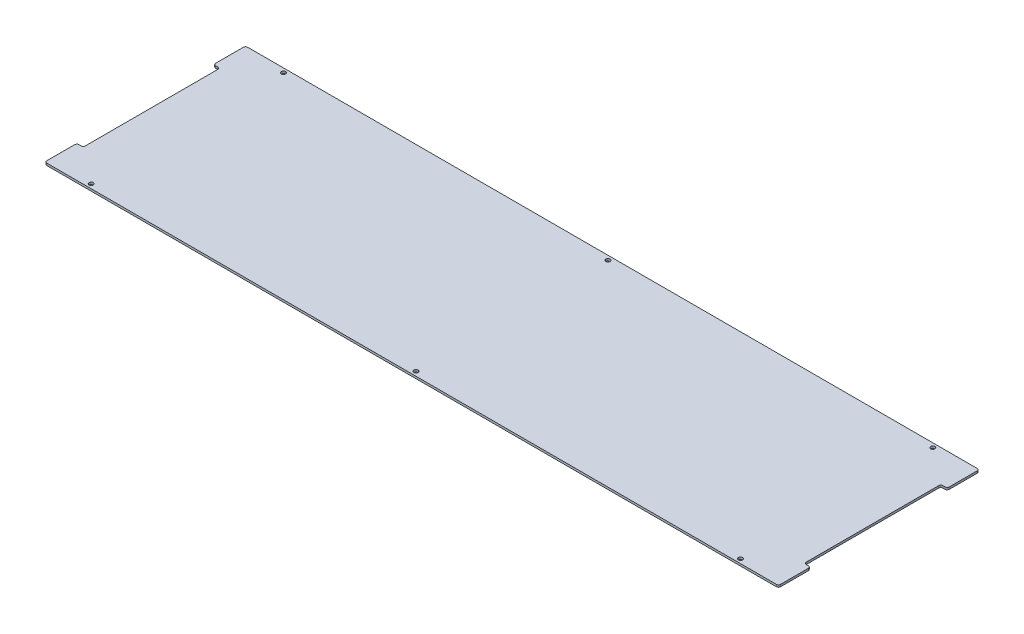
from build123d import *

# Parameters (mm, degrees)
SKETCH1_W                   = 1090.6125
SKETCH1_H                   = 298.45
BOSS_EXTRUDE1_DEPTH         = 3.175
SKETCH2_W                   = 9.525
SKETCH2_H                   = 203.2
CUT_EXTRUDE1_DEPTH          = 566.364561623
FILLET1_R                   = 3.175
FILLET1_OF_MIRROR1_R        = 3.175
F_1_4_0_25_DIAMETER_HOLE1_D = 6.35
FILLET2_R                   = 3.175


with BuildPart() as part:
    # Sketch1 → Boss-Extrude1 (new body)
    with BuildSketch(Plane(origin=(0, 0, 0), x_dir=(1, 0, 0), z_dir=(0, 1, 0))):
        Rectangle(SKETCH1_W, SKETCH1_H)
    extrude(amount=BOSS_EXTRUDE1_DEPTH)

    # Sketch2 → Cut-Extrude1 (cut, through all)
    with BuildSketch(Plane(origin=(0, 3.175, 0), x_dir=(1, 0, 0), z_dir=(0, 1, 0))):
        with Locations((540.54375, 0)):
            Rectangle(SKETCH2_W, SKETCH2_H)
    cut_extrude1 = extrude(amount=-CUT_EXTRUDE1_DEPTH, mode=Mode.SUBTRACT)

    # Fillet1
    fillet1_edges = [part.edges().sort_by_distance(p)[0] for p in [
        (535.78125, 1.5875, 101.6),
        (535.78125, 1.5875, -101.6),
    ]]
    fillet(fillet1_edges, radius=FILLET1_R)

    # Mirror1: Cut-Extrude1 across plane
    add(cut_extrude1.mirror(Plane(origin=(0, 0, 0), x_dir=(0, 0, 1), z_dir=(1, 0, 0))), mode=Mode.SUBTRACT)

    # Fillet1 of Mirror1
    fillet1_of_mirror1_edges = [part.edges().sort_by_distance(p)[0] for p in [
        (-535.78125, 1.5875, 101.6),
        (-535.78125, 1.5875, -101.6),
    ]]
    fillet(fillet1_of_mirror1_edges, radius=FILLET1_OF_MIRROR1_R)

    # 1/4 (0.25) Diameter Hole1 (through all)
    with Locations(Plane(origin=(0, 3.175, 0), x_dir=(1, 0, 0), z_dir=(0, 1, 0))):
        with Locations((482.6, 142.875), (0, 142.875), (-482.6, 142.875)):
            f_1_4_0_25_diameter_hole1 = Hole(F_1_4_0_25_DIAMETER_HOLE1_D / 2)

    # Mirror2: 1/4 (0.25) Diameter Hole1 across plane
    add(f_1_4_0_25_diameter_hole1.mirror(Plane.XY), mode=Mode.SUBTRACT)

    # Fillet2
    fillet2_edges = [part.edges().sort_by_distance(p)[0] for p in [
        (-545.30625, 1.5875, 149.225),
        (-545.30625, 1.5875, 101.6),
        (-545.30625, 1.5875, -101.6),
        (-545.30625, 1.5875, -149.225),
        (545.30625, 1.5875, 149.225),
        (545.30625, 1.5875, 101.6),
        (545.30625, 1.5875, -101.6),
        (545.30625, 1.5875, -149.225),
    ]]
    fillet(fillet2_edges, radius=FILLET2_R)


solid = part.part
